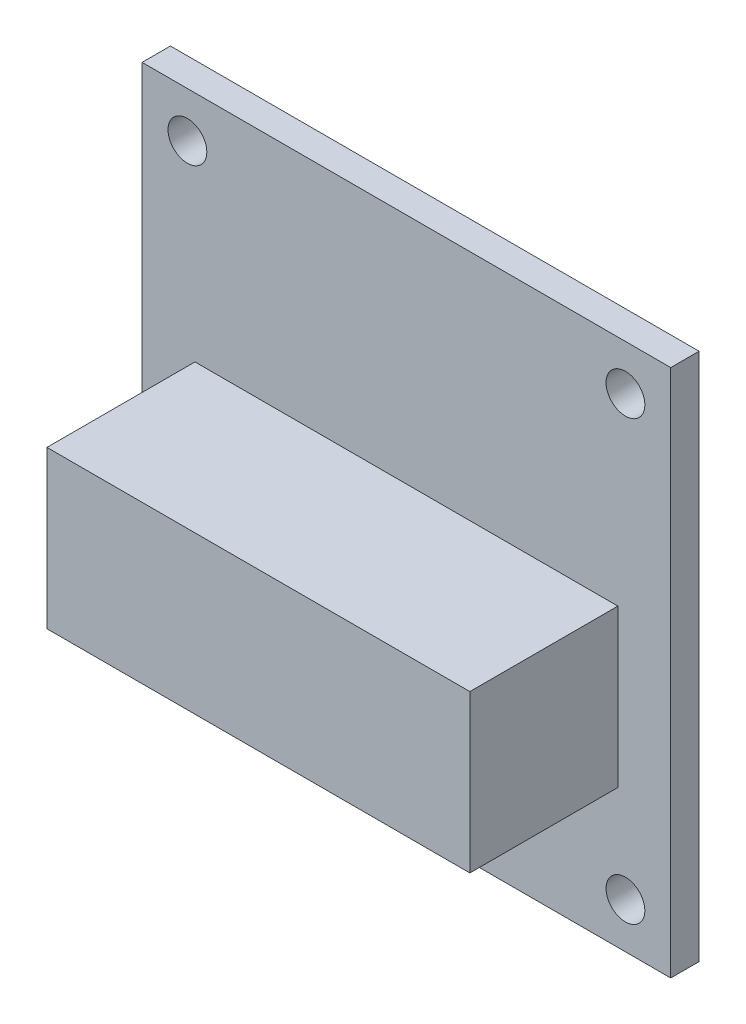
from build123d import *

# Parameters (mm, degrees)
SKETCH1_W           = 44.45
SKETCH1_H           = 44.45
BOSS_EXTRUDE1_DEPTH = 2.38125
SKETCH2_W           = 35.56
SKETCH2_H           = 13.208
BOSS_EXTRUDE2_DEPTH = 12.446


with BuildPart() as part:
    # Sketch1 → Boss-Extrude1 (new body)
    with BuildSketch(Plane.XY):
        Rectangle(SKETCH1_W, SKETCH1_H)
    extrude(amount=BOSS_EXTRUDE1_DEPTH)

    # Sketch5 → #4 Clearance Hole1 (revolve, cut)
    with BuildSketch(Plane(origin=(-18.415, 18.415, 2.38125), x_dir=(0, -1, 0), z_dir=(1, 0, 0))):
        Polygon((0, 0), (0, 4.155574487), (1.63195, 3.175), (1.63195, 0), align=None)
    f_4_clearance_hole1 = revolve(axis=Axis((-18.415, 18.415, 8.73125), (0, 0, -1)), mode=Mode.SUBTRACT)

    # Mirror1: #4 Clearance Hole1 across plane
    add(f_4_clearance_hole1.mirror(Plane(origin=(0, 0, 0), x_dir=(0, 0, 1), z_dir=(1, 0, 0))), mode=Mode.SUBTRACT)

    # Mirror2 copy 1 sketch → Mirror2 copy 1 (revolve, cut)
    with BuildSketch(Plane(origin=(18.415, -18.415, 2.38125), x_dir=(0, 1, 0), z_dir=(-1, 0, 0))):
        Polygon((0, 0), (0, 4.155574487), (1.63195, 3.175), (1.63195, 0), align=None)
    revolve(axis=Axis((18.415, -18.415, 8.73125), (0, 0, -1)), mode=Mode.SUBTRACT)

    # Mirror2 copy 2 sketch → Mirror2 copy 2 (revolve, cut)
    with BuildSketch(Plane(origin=(-18.415, -18.415, 2.38125), x_dir=(0, 1, 0), z_dir=(1, 0, 0))):
        Polygon((0, 0), (0, -4.155574487), (1.63195, -3.175), (1.63195, 0), align=None)
    revolve(axis=Axis((-18.415, -18.415, 8.73125), (0, 0, 1)), mode=Mode.SUBTRACT)

    # Sketch2 → Boss-Extrude2 (add)
    with BuildSketch(Plane.XY.offset(2.38125)):
        with Locations((0, -3.970482907)):
            Rectangle(SKETCH2_W, SKETCH2_H)
    extrude(amount=BOSS_EXTRUDE2_DEPTH)


solid = part.part
